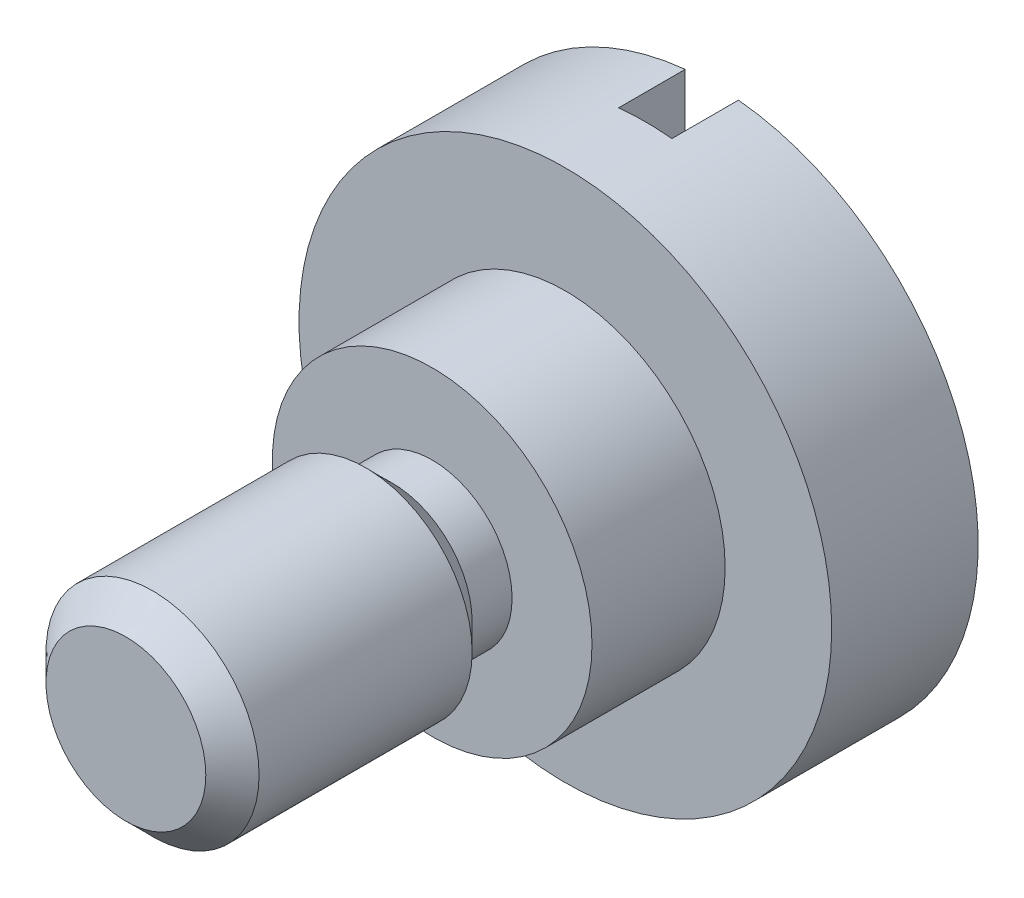
from build123d import *

# Parameters (mm, degrees)
SKETCH_1_R          = 10
EXTRUDE_1_DEPTH     = 5.5
SKETCH_2_R          = 6
EXTRUDE_2_DEPTH     = 5
SKETCH_3_R          = 3
EXTRUDE_3_DEPTH     = 1.5
SKETCH_4_R          = 4
EXTRUDE_4_DEPTH     = 10
CHAMFER_1_SIZE      = 1
SKETCH_5_W          = 2
SKETCH_5_H          = 20
CUT_EXTRUDE_1_DEPTH = 2.5


with BuildPart() as part:
    # 草图1 → 凸台-拉伸1 (new body)
    with BuildSketch(Plane.XY):
        Circle(SKETCH_1_R)
    extrude(amount=EXTRUDE_1_DEPTH)

    # 草图2 → 凸台-拉伸2 (add)
    with BuildSketch(Plane.XY.offset(5.5)):
        Circle(SKETCH_2_R)
    extrude(amount=EXTRUDE_2_DEPTH)

    # 草图3 → 凸台-拉伸3 (add)
    with BuildSketch(Plane.XY.offset(10.5)):
        Circle(SKETCH_3_R)
    extrude(amount=EXTRUDE_3_DEPTH)

    # 草图4 → 凸台-拉伸4 (add)
    with BuildSketch(Plane.XY.offset(12)):
        Circle(SKETCH_4_R)
    extrude(amount=EXTRUDE_4_DEPTH)

    # 倒角1
    chamfer_1_edges = [part.edges().sort_by_distance(p)[0] for p in [
        (-4, 0, 12),
        (-4, 0, 22),
    ]]
    chamfer(chamfer_1_edges, length=CHAMFER_1_SIZE - 0.0001)  # a hair under: the kernel refuses the full size

    # 草图5 → 切除-拉伸-薄壁1 (cut)
    with BuildSketch(Plane(origin=(0, 0, 0), x_dir=(-1, 0, 0), z_dir=(0, 0, -1))):
        Rectangle(SKETCH_5_W, SKETCH_5_H)
    extrude(amount=-CUT_EXTRUDE_1_DEPTH, mode=Mode.SUBTRACT)


solid = part.part
